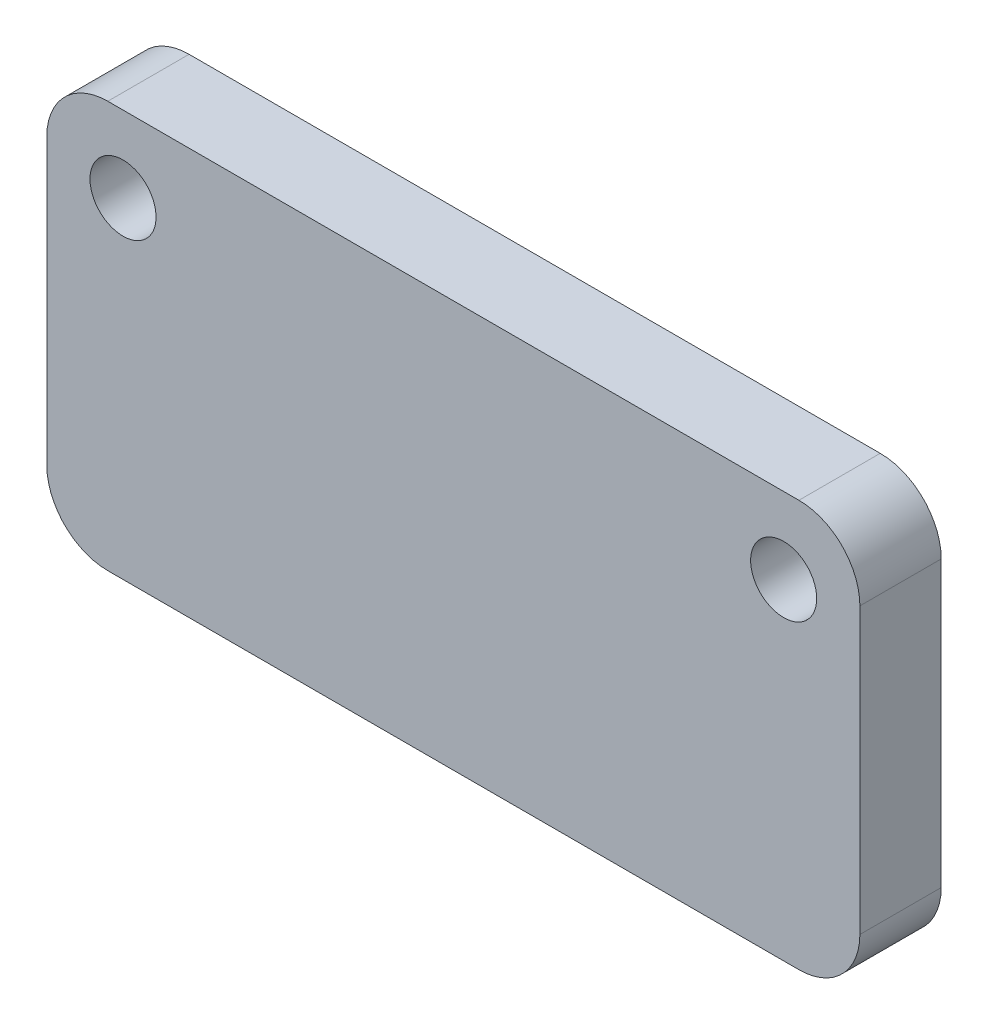
from build123d import *

# Parameters (mm, degrees)
SKETCH2_R           = 1.625
BOSS_EXTRUDE1_DEPTH = 4
FILLET1_R           = 3


with BuildPart() as part:
    # Sketch2 → Boss-Extrude1 (new body)
    with BuildSketch(Plane.XY):
        Polygon((0, 0), (20, 0), (20, 20), (-20, 20), (-20, 0), align=None)
        with Locations((16.25, 16.25)):
            Circle(SKETCH2_R, mode=Mode.SUBTRACT)
        with Locations((-16.25, 16.25)):
            Circle(SKETCH2_R, mode=Mode.SUBTRACT)
    extrude(amount=BOSS_EXTRUDE1_DEPTH)

    # Fillet1
    fillet1_edges = [part.edges().sort_by_distance(p)[0] for p in [
        (20, 0, 2),
        (20, 20, 2),
        (-20, 0, 2),
        (-20, 20, 2),
    ]]
    fillet(fillet1_edges, radius=FILLET1_R)


solid = part.part
